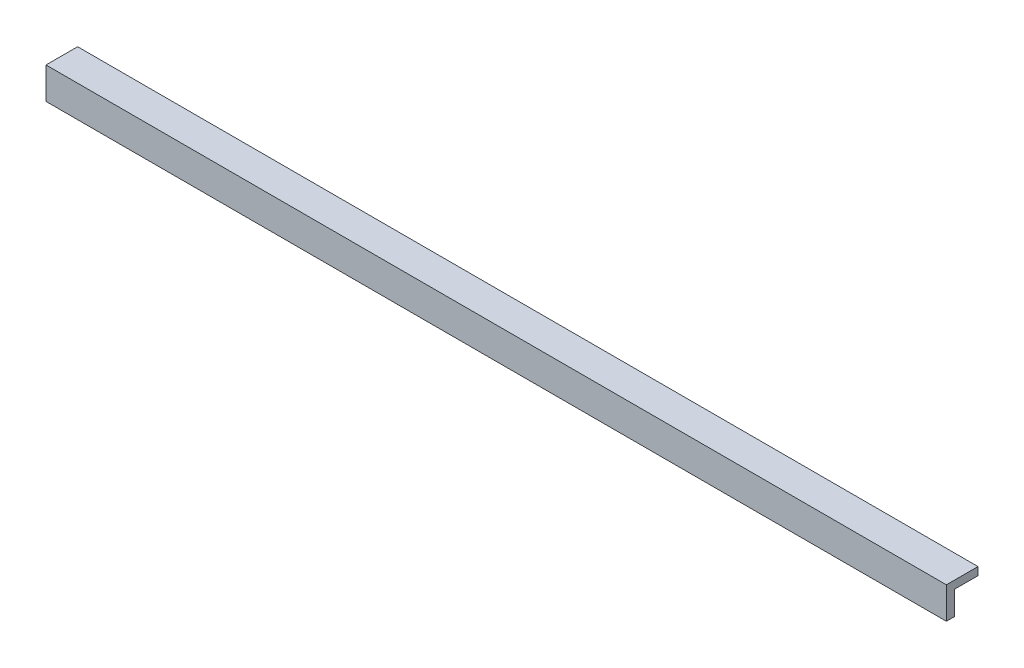
from build123d import *

# Parameters (mm, degrees)
BOSS_EXTRUDE1_DEPTH = 180.848


with BuildPart() as part:
    # Sketch1 → Boss-Extrude1 (new body)
    with BuildSketch(Plane(origin=(0, 0, 0), x_dir=(0, 0, -1), z_dir=(1, 0, 0))):
        Polygon((0, 0), (0, 6.35), (6.35, 6.35), (6.35, 4.7625), (1.5875, 4.7625), (1.5875, 0), align=None)
    extrude(amount=BOSS_EXTRUDE1_DEPTH)


solid = part.part
